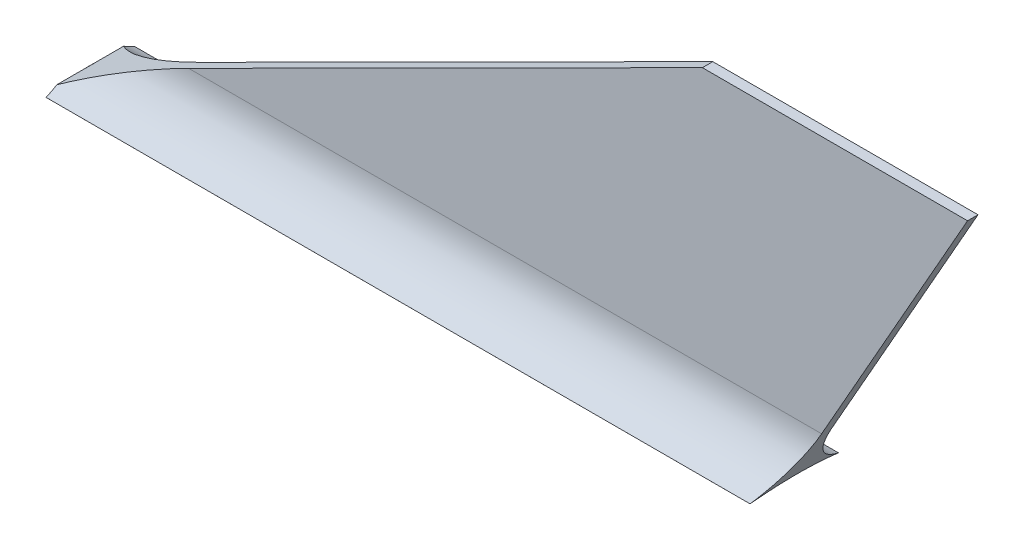
from build123d import *

# Parameters (mm, degrees)
BOSS_EXTRUDE1_DEPTH = 2.9972
EXTRUDE_THIN1_REACH = 270.741
FILLET1_R           = 17.78


with BuildPart() as part:
    # Sketch1 → Boss-Extrude1 (new body)
    with BuildSketch(Plane.XY):
        Polygon((0, 0), (177.3936, 88.9), (253.5936, 88.9), (203.2, 0), (127, 0), (127, -12.7), (76.9874, -12.7), (76.9874, 0), align=None)
    extrude(amount=BOSS_EXTRUDE1_DEPTH)

    # Extrude-Thin1: up to this plane
    extrude_thin1_end = Plane(origin=(253.5936, 88.9, 2.9972), z_dir=(-0.8699511006630548, 0.4931379953472858, 0))
    # Sketch2 → Extrude-Thin1 (add, up to the surface)
    with BuildSketch(Plane(origin=(0, 0, 0), x_dir=(0, 0, -1), z_dir=(1, 0, 0)), mode=Mode.PRIVATE) as extrude_thin1_sk1:
        with BuildLine():
            ThreePointArc((-14.1986, -1.591002342), (-1.4986, 0.022109161), (11.2014, -1.591002342))
            Line((11.2014, -1.591002342), (11.200765, -1.593461686))
            ThreePointArc((11.200765, -1.593461686), (-1.4986, 0.019569161), (-14.197965, -1.593461686))
            Line((-14.197965, -1.593461686), (-14.1986, -1.591002342))
        make_face()
    extrude_thin1_tool1 = split(extrude(extrude_thin1_sk1.sketch, amount=EXTRUDE_THIN1_REACH, mode=Mode.PRIVATE), bisect_by=extrude_thin1_end, keep=Keep.BOTH, mode=Mode.PRIVATE)
    add(extrude_thin1_tool1.solids().sort_by_distance((0, -1.528604, -10.954651))[0])

    # Fillet1
    # the kernel refuses this fillet: 17.78 mm, written as the material it adds along each edge
    with BuildSketch(Plane(origin=(0, 0, 0), x_dir=(0, -0.1406246122093386, -0.9900629871078774), z_dir=(1, 0, 0))) as fillet1_piece_1_section:
        with BuildLine():
            CenterArc((15.504190696, 17.279156247), FILLET1_R, 188.083991465, 68.284382717)
            Line((-2.099129215, 14.778850642), (0, 0))
            ThreePointArc((0, 0), (5.656912816, 0.315949673), (11.313825631, 0))
        make_face()
    fillet1_piece_1 = extrude(amount=240.517955612, mode=Mode.PRIVATE)
    fillet1_piece_1 = split(fillet1_piece_1, bisect_by=Plane(origin=(86.561023995, 43.379665519, -3.035000441), z_dir=(0.4480326676326847, -0.89401718592762, 0)), keep=Keep.TOP, mode=Mode.PRIVATE)
    fillet1_piece_1 = split(fillet1_piece_1, bisect_by=Plane(origin=(181.635497998, -38.042216233, -3.035000441), z_dir=(-0.8699511006630548, 0.4931379953472858, 0)), keep=Keep.TOP, mode=Mode.PRIVATE)
    add(fillet1_piece_1)
    with BuildSketch(Plane(origin=(240.517955612, 0, 2.9972), x_dir=(0, 1, 0), z_dir=(-1, 0, 0))) as fillet1_piece_2_section:
        with BuildLine():
            CenterArc((14.927182245, -17.78), FILLET1_R, 90, 68.284382717)
            ThreePointArc((-1.591002342, -11.2014), (-0.482691094, -5.6451303), (0, 0))
            Line((0, 0), (14.927182245, 0))
        make_face()
    fillet1_piece_2 = extrude(amount=240.517955612, mode=Mode.PRIVATE)
    fillet1_piece_2 = split(fillet1_piece_2, bisect_by=Plane(origin=(86.561023995, 43.379665519, 6.032200441), z_dir=(0.4480326676326847, -0.89401718592762, 0)), keep=Keep.TOP, mode=Mode.PRIVATE)
    fillet1_piece_2 = split(fillet1_piece_2, bisect_by=Plane(origin=(181.635497998, -38.042216233, 6.032200441), z_dir=(-0.8699511006630548, 0.4931379953472858, 0)), keep=Keep.TOP, mode=Mode.PRIVATE)
    add(fillet1_piece_2)


solid = part.part
